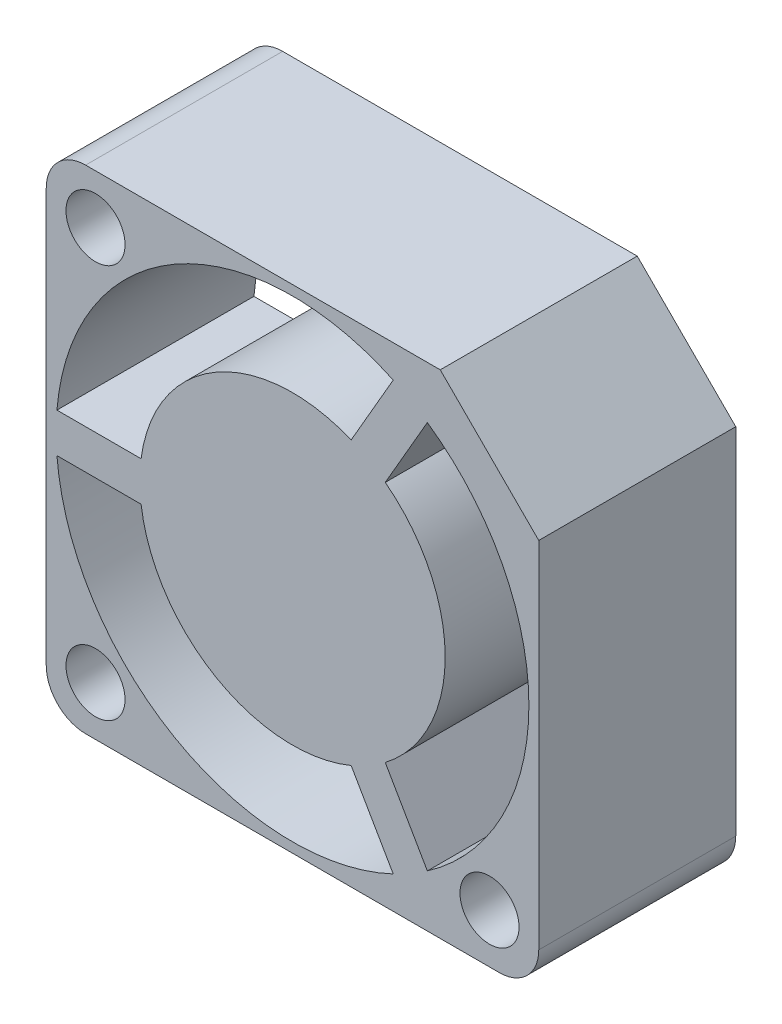
from build123d import *

# Parameters (mm, degrees)
SZKIC1_R                    = 1.5
DODANIE_WYCI_GNI_CIE1_DEPTH = 10


with BuildPart() as part:
    # Szkic1 → Dodanie-wyciągnięcie1 (new body)
    with BuildSketch(Plane.XY):
        with BuildLine():
            Line((-10.5, 12.5), (7.5, 12.5))
            Line((7.5, 12.5), (12.5, 7.5))
            Line((12.5, 7.5), (12.5, -10.5))
            ThreePointArc((12.5, -10.5), (11.914213562, -11.914213562), (10.5, -12.5))
            Line((10.5, -12.5), (-10.5, -12.5))
            ThreePointArc((-10.5, -12.5), (-11.914213562, -11.914213562), (-12.5, -10.5))
            Line((-12.5, -10.5), (-12.5, 10.5))
            ThreePointArc((-12.5, 10.5), (-11.914213562, 11.914213562), (-10.5, 12.5))
        make_face()
        with Locations((-10, 10)):
            Circle(SZKIC1_R, mode=Mode.SUBTRACT)
        with Locations((-10, -10)):
            Circle(SZKIC1_R, mode=Mode.SUBTRACT)
        with Locations((10, -10)):
            Circle(SZKIC1_R, mode=Mode.SUBTRACT)
        with BuildLine():
            Line((-7.685213074, 1), (-11.958260743, 1))
            ThreePointArc((-11.958260743, 1), (-6, 10.392304845), (5.113104968, 10.856157589))
            Line((5.113104968, 10.856157589), (2.976581133, 7.155589756))
            ThreePointArc((2.976581133, 7.155589756), (-3.875, 6.711696879), (-7.685213074, 1))
        make_face(mode=Mode.SUBTRACT)
        with BuildLine():
            Line((-11.958260743, -1), (-7.685213074, -1))
            ThreePointArc((-7.685213074, -1), (-3.875, -6.711696879), (2.976581133, -7.155589756))
            Line((2.976581133, -7.155589756), (5.113104968, -10.856157589))
            ThreePointArc((5.113104968, -10.856157589), (-6, -10.392304845), (-11.958260743, -1))
        make_face(mode=Mode.SUBTRACT)
        with BuildLine():
            Line((4.708631941, 6.155589756), (6.845155775, 9.856157589))
            ThreePointArc((6.845155775, 9.856157589), (12, 0), (6.845155775, -9.856157589))
            Line((6.845155775, -9.856157589), (4.708631941, -6.155589756))
            ThreePointArc((4.708631941, -6.155589756), (7.75, 0), (4.708631941, 6.155589756))
        make_face(mode=Mode.SUBTRACT)
    extrude(amount=DODANIE_WYCI_GNI_CIE1_DEPTH)


solid = part.part
